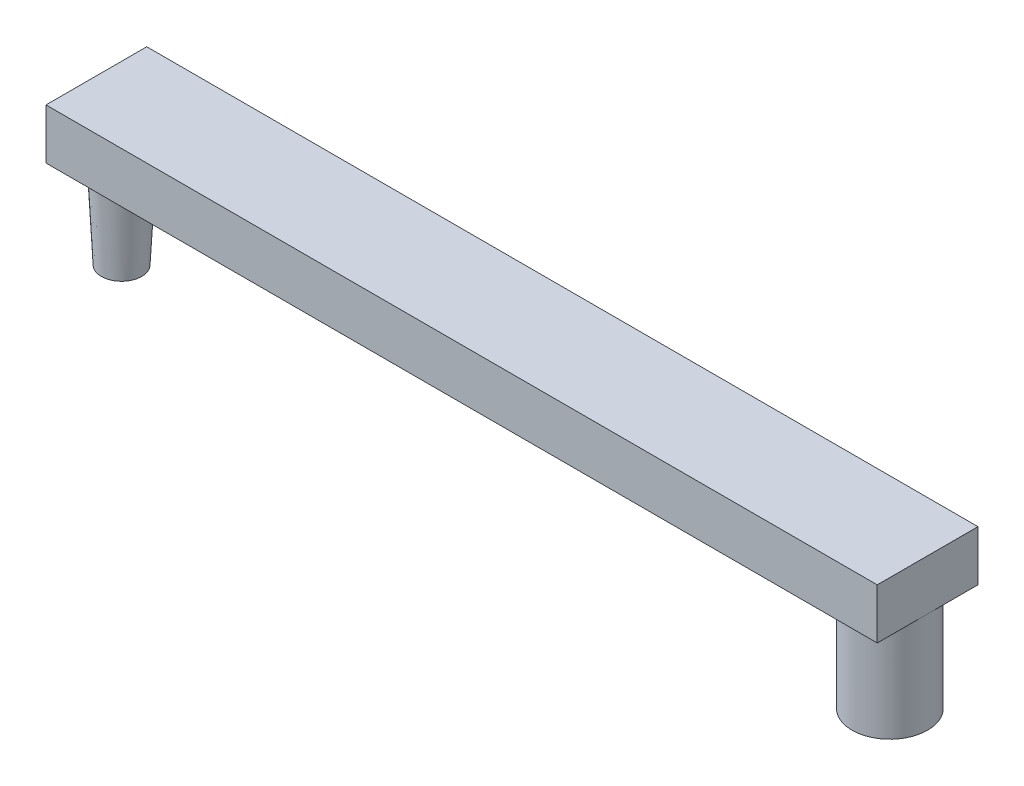
from build123d import *

# Parameters (mm, degrees)
CROQUIS2_W              = 16.5
CROQUIS2_H              = 2
SALIENTE_EXTRUIR2_DEPTH = 1
CROQUIS3_R              = 0.75
CROQUIS3_R_2            = 0.5
SALIENTE_EXTRUIR3_DEPTH = 2


with BuildPart() as part:
    # Croquis2 → Saliente-Extruir2 (new body)
    with BuildSketch(Plane(origin=(0, 0, 0), x_dir=(1, 0, 0), z_dir=(0, 1, 0))):
        Rectangle(CROQUIS2_W, CROQUIS2_H)
    extrude(amount=SALIENTE_EXTRUIR2_DEPTH)

    # Croquis3 → Saliente-Extruir3 (add)
    with BuildSketch(Plane.XZ):
        with Locations((7.5, 0)):
            Circle(CROQUIS3_R)
        with Locations((-7.75, 0)):
            Circle(CROQUIS3_R_2)
    extrude(amount=SALIENTE_EXTRUIR3_DEPTH)

    # Croquis4 → Cortar-Revolución2 (revolve, cut)
    with BuildSketch(Plane.XY):
        Polygon((-8.15, -2), (-8.25, -2), (-8.25, 0), align=None)
        Polygon((-7.25, 0), (-7.25, -2), (-7.35, -2), align=None)
    revolve(axis=Axis((-7.75, 0, 0), (0, -1, 0)), mode=Mode.SUBTRACT)


solid = part.part
